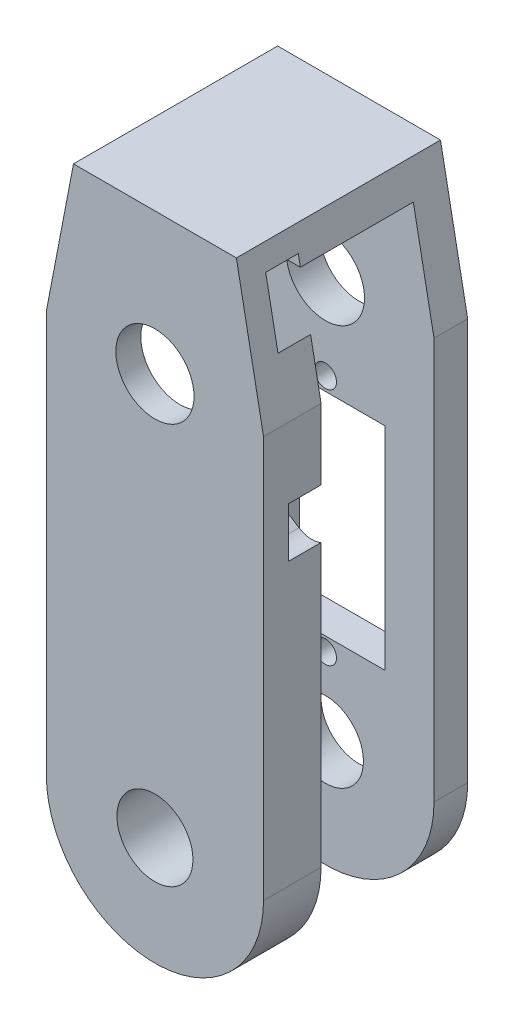
from build123d import *

# Parameters (mm, degrees)
SKETCH1_R              = 4.572
SKETCH1_R_2            = 4.445
BOSS_EXTRUDE1_DEPTH    = 6.731
BOSS_EXTRUDE3_START    = -13.208
SKETCH1_5_R            = 4.572
SKETCH1_5_R_2          = 1.2954
SKETCH1_5_R_3          = 4.445
SKETCH1_5_W            = 13.97
SKETCH1_5_H            = 24.765
BOSS_EXTRUDE3_DEPTH    = 3.937
CUT_EXTRUDE4_START     = -3.81
CUT_EXTRUDE4_OUTLINE_R = 4.572
CUT_EXTRUDE4_DEPTH     = 3.81
BOSS_EXTRUDE5_DEPTH    = 16.4211


# Read off the part's stored shape, not the designer's step: Cut-Extrude4
with BuildPart() as part:
    # Sketch1 (on Front Plane) → Boss-Extrude1 (new body)
    with BuildSketch(Plane.XY):
        with BuildLine():
            Line((-12.7, 0), (-9.525, 16.51))
            Line((-9.525, 16.51), (9.525, 16.51))
            Line((9.525, 16.51), (12.7, 0))
            Line((12.7, 0), (12.7, -46.99))
            ThreePointArc((12.7, -46.99), (0, -59.69), (-12.7, -46.99))
            Line((-12.7, -46.99), (-12.7, 0))
        make_face()
        Circle(SKETCH1_R, mode=Mode.SUBTRACT)
        with Locations((0, -46.99)):
            Circle(SKETCH1_R_2, mode=Mode.SUBTRACT)
    extrude(amount=BOSS_EXTRUDE1_DEPTH)

    # Cut-Extrude4 outline → Cut-Extrude4 (cut)
    with BuildSketch(Plane(origin=(0, 0, 0), x_dir=(-1, 0, 0), z_dir=(0, 0, -1)).offset(CUT_EXTRUDE4_START)):
        with BuildLine():
            Line((1.021082558, -8.023816422), (10.113003756, -13.894226547))
            ThreePointArc((10.113003756, -13.894226547), (11.380658922, -14.323016968), (12.7, -14.099075092))
            Line((12.7, -14.099075092), (12.7, 0))
            Line((12.7, 0), (10.037418608, 13.84542324))
            Line((10.037418608, 13.84542324), (1.021082558, 8.023816422))
            ThreePointArc((1.021082558, 8.023816422), (0, 7.408645479), (-1.021082558, 8.023816422))
            Line((-1.021082558, 8.023816422), (-10.037418608, 13.84542324))
            Line((-10.037418608, 13.84542324), (-11.47556666, 6.367053366))
            Line((-11.47556666, 6.367053366), (-8.023816422, 1.021082558))
            ThreePointArc((-8.023816422, 1.021082558), (-7.408645479, 0), (-8.023816422, -1.021082558))
            Line((-8.023816422, -1.021082558), (-12.7, -8.263420264))
            Line((-12.7, -8.263420264), (-12.7, -14.099075092))
            ThreePointArc((-12.7, -14.099075092), (-11.380658922, -14.323016968), (-10.113003756, -13.894226547))
            Line((-10.113003756, -13.894226547), (-1.021082558, -8.023816422))
            ThreePointArc((-1.021082558, -8.023816422), (0, -7.408645479), (1.021082558, -8.023816422))
        make_face()
        Circle(CUT_EXTRUDE4_OUTLINE_R, mode=Mode.SUBTRACT)
    extrude(amount=CUT_EXTRUDE4_DEPTH, mode=Mode.SUBTRACT)



with BuildPart() as body_2:
    # Sketch1<5> → Boss-Extrude3 (new body)
    with BuildSketch(Plane.XY.offset(BOSS_EXTRUDE3_START)):
        with BuildLine():
            Line((-12.7, 0), (-9.525, 16.51))
            Line((-9.525, 16.51), (9.525, 16.51))
            Line((9.525, 16.51), (12.7, 0))
            Line((12.7, 0), (12.7, -46.99))
            ThreePointArc((12.7, -46.99), (0, -59.69), (-12.7, -46.99))
            Line((-12.7, -46.99), (-12.7, 0))
        make_face()
        Circle(SKETCH1_5_R, mode=Mode.SUBTRACT)
        with Locations((0, -10.16)):
            Circle(SKETCH1_5_R_2, mode=Mode.SUBTRACT)
        with Locations((0, -38.1)):
            Circle(SKETCH1_5_R_2, mode=Mode.SUBTRACT)
        with Locations((0, -46.99)):
            Circle(SKETCH1_5_R_3, mode=Mode.SUBTRACT)
        with Locations((0, -24.13)):
            Rectangle(SKETCH1_5_W, SKETCH1_5_H, mode=Mode.SUBTRACT)
    extrude(amount=-BOSS_EXTRUDE3_DEPTH)


with BuildPart() as part_1:
    add(part.part)

    add(body_2.part)  # Boss-Extrude5 merges body 2
    # Sketch5 → Boss-Extrude5 (add)
    with BuildSketch(Plane(origin=(0, 0, 0), x_dir=(-1, 0, 0), z_dir=(0, 0, -1))):
        Polygon((-9.525, 16.51), (9.525, 16.51), (10.282115385, 12.573), (-10.282115385, 12.573), align=None)
    extrude(amount=BOSS_EXTRUDE5_DEPTH)


solid = part_1.part
